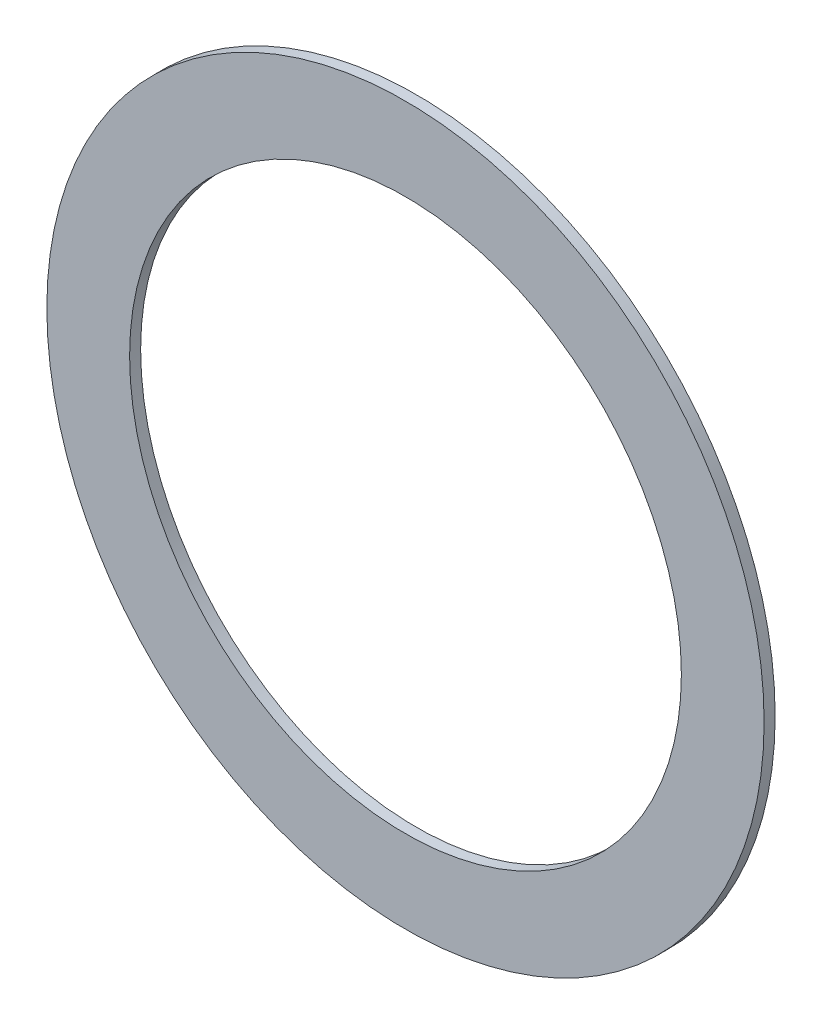
from build123d import *

# Parameters (mm, degrees)
SKETCH_1_R          = 65
EXTRUDE_1_DEPTH     = 2
SKETCH_2_R          = 50
CUT_EXTRUDE_1_DEPTH = 2


with BuildPart() as part:
    # 草圖1 → 填料-伸長1 (new body)
    with BuildSketch(Plane.XY):
        Circle(SKETCH_1_R)
    extrude(amount=EXTRUDE_1_DEPTH)

    # 草圖2 → 除料-伸長1 (cut)
    with BuildSketch(Plane.XY.offset(2)):
        Circle(SKETCH_2_R)
    extrude(amount=-CUT_EXTRUDE_1_DEPTH, mode=Mode.SUBTRACT)


solid = part.part
